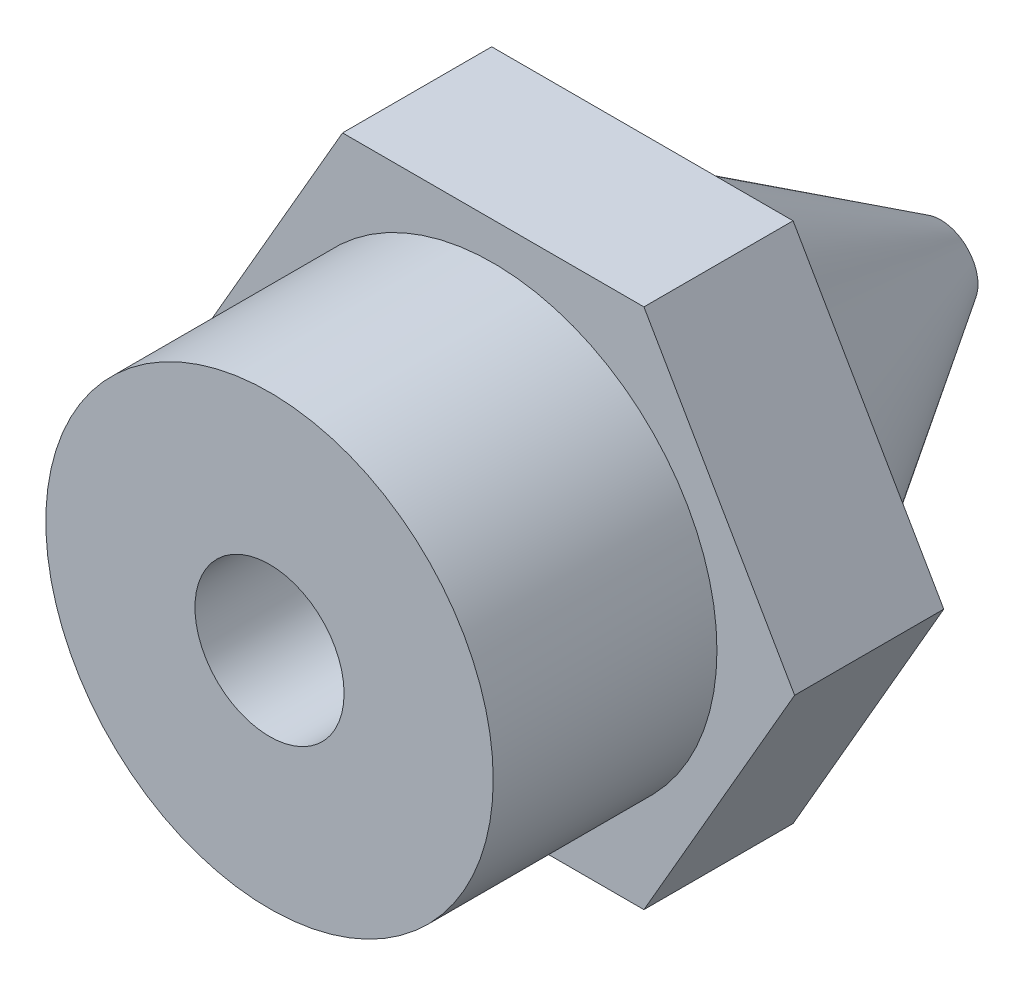
from build123d import *

# Parameters (mm, degrees)
BOSS_EXTRU_1_DEPTH      = 9
ESQUISSE2_W             = 19.623971562
ESQUISSE2_H             = 15.534154535
ESQUISSE2_R             = 3
ENL_V_MAT_EXTRU_1_DEPTH = 3
ENL_V_START             = -4
ESQUISSE3_W             = 11.267201257
ESQUISSE3_H             = 13.961169169
ESQUISSE3_R             = 3
ENL_V_MAT_EXTRU_2_DEPTH = 4
CHANFREIN1_SIZE         = 4
CHANFREIN1_SIZE_2       = 2.499477408


with BuildPart() as part:
    # Esquisse1 → Boss.-Extru.1 (new body)
    with BuildSketch(Plane.XY):
        Polygon((4.041451884, 0), (2.020725942, 3.5), (-2.020725942, 3.5), (-4.041451884, 0), (-2.020725942, -3.5), (2.020725942, -3.5), align=None)
    extrude(amount=BOSS_EXTRU_1_DEPTH)

    # Esquisse2 → Enlèv. mat.-Extru.1 (cut)
    with BuildSketch(Plane.XY.offset(9)):
        with Locations((0.327116653, -1.544441398)):
            Rectangle(ESQUISSE2_W, ESQUISSE2_H)
        Circle(ESQUISSE2_R, mode=Mode.SUBTRACT)
    extrude(amount=-ENL_V_MAT_EXTRU_1_DEPTH, mode=Mode.SUBTRACT)

    # Esquisse3 → Enlèv. mat.-Extru.2 (cut)
    with BuildSketch(Plane(origin=(0, 0, 0), x_dir=(-1, 0, 0), z_dir=(0, 0, -1)).offset(ENL_V_START)):
        with Locations((0.009770186, 0.039262349)):
            Rectangle(ESQUISSE3_W, ESQUISSE3_H)
        with Locations(Location((0, 0, 0), (0, 0, 180))):
            Circle(ESQUISSE3_R, mode=Mode.SUBTRACT)
    extrude(amount=ENL_V_MAT_EXTRU_2_DEPTH, mode=Mode.SUBTRACT)

    # Chanfrein1
    # the kernel refuses this chamfer: 4, 2.499477408 mm, written as the material it takes off along each edge
    with BuildSketch(Plane(origin=(0, 0, 0), x_dir=(1, 0, 0), z_dir=(0, 1, 0))) as chanfrein1_piece_1_section:
        Polygon((3, -CHANFREIN1_SIZE), (3 - CHANFREIN1_SIZE_2, 0), (3, 0), align=None)
    chanfrein1_piece_1 = revolve(axis=Axis((0, 0, 0), (0, 0, -1)), mode=Mode.PRIVATE)
    chanfrein1_piece_1 = split(chanfrein1_piece_1, bisect_by=Plane(origin=(-1.744026904, 0, 4), z_dir=(0, 0, -1)), keep=Keep.TOP, mode=Mode.PRIVATE)
    add(chanfrein1_piece_1, mode=Mode.SUBTRACT)

    # Esquisse4 → Enlèvement de matière-Révolution1 (revolve, cut)
    with BuildSketch(Plane(origin=(0, 0, 0), x_dir=(1, 0, 0), z_dir=(0, 1, 0))):
        Polygon((0, -9), (1, -9), (1, -6.108259821), (0.25, 0), (0, 0), align=None)
    revolve(axis=Axis((0, 0, 10.381605157), (0, 0, -1)), mode=Mode.SUBTRACT)


solid = part.part
